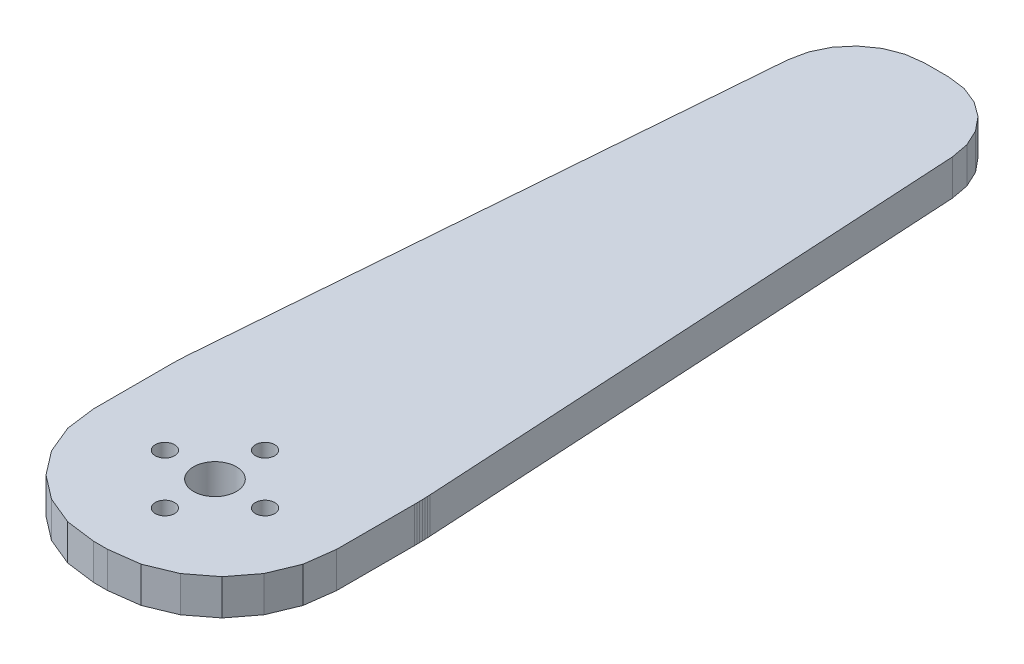
from build123d import *

# Parameters (mm, degrees)
BOSS_1_DEPTH = 5
S_HOLE2_R    = 3
HOLE_2_DEPTH = 5.2
S_HOLE3_R    = 1.35
HOLE_3_DEPTH = 5.2
S_HOLE4_R    = 1.35
HOLE_4_DEPTH = 5.2
S_HOLE5_R    = 1.35
HOLE_5_DEPTH = 5.2
S_HOLE6_R    = 1.35
HOLE_6_DEPTH = 5.2


with BuildPart() as part:
    # S_prism1 → Boss_1 (new body)
    with BuildSketch(Plane(origin=(0, -5, 0), x_dir=(1, 0, 0), z_dir=(0, 1, 0))):
        Polygon((-17, 0), (-16.455, -4.141), (-14.856, -8), (-12.314, -11.314), (-9, -13.856), (-5.141, -15.455), (-1, -16), (1, -16), (5.141, -15.455), (9, -13.856), (12.314, -11.314), (14.856, -8), (16.455, -4.141), (17, 0), (17, 10.865), (16.998, 11.243), (16.993, 11.621), (16.984, 12), (16.971, 12.378), (16.955, 12.756), (16.936, 13.134), (12.536, 90.567), (12.078, 93.042), (11.017, 95.324), (9.42, 97.269), (7.387, 98.753), (5.049, 99.683), (2.552, 100), (-0.764, 100), (-3.224, 99.693), (-5.533, 98.79), (-7.549, 97.346), (-9.148, 95.451), (-10.231, 93.221), (-10.732, 90.793), (-16.874, 13.583), (-16.913, 13.056), (-16.944, 12.527), (-16.968, 11.999), (-16.986, 11.47), (-16.996, 10.941), (-17, 10.412), align=None)
    extrude(amount=BOSS_1_DEPTH)

    # S_hole2 → Hole_2 (cut)
    with BuildSketch(Plane(origin=(0, -5.1, 0), x_dir=(1, 0, 0), z_dir=(0, 1, 0))):
        Circle(S_HOLE2_R)
    extrude(amount=HOLE_2_DEPTH, mode=Mode.SUBTRACT)

    # S_hole3 → Hole_3 (cut)
    with BuildSketch(Plane(origin=(0, -5.1, 0), x_dir=(1, 0, 0), z_dir=(0, 1, 0))):
        with Locations((7, 0)):
            Circle(S_HOLE3_R)
    extrude(amount=HOLE_3_DEPTH, mode=Mode.SUBTRACT)

    # S_hole4 → Hole_4 (cut)
    with BuildSketch(Plane(origin=(0, -5.1, 0), x_dir=(1, 0, 0), z_dir=(0, 1, 0))):
        with Locations((0, -7)):
            Circle(S_HOLE4_R)
    extrude(amount=HOLE_4_DEPTH, mode=Mode.SUBTRACT)

    # S_hole5 → Hole_5 (cut)
    with BuildSketch(Plane(origin=(0, -5.1, 0), x_dir=(1, 0, 0), z_dir=(0, 1, 0))):
        with Locations((-7, 0)):
            Circle(S_HOLE5_R)
    extrude(amount=HOLE_5_DEPTH, mode=Mode.SUBTRACT)

    # S_hole6 → Hole_6 (cut)
    with BuildSketch(Plane(origin=(0, -5.1, 0), x_dir=(1, 0, 0), z_dir=(0, 1, 0))):
        with Locations((0, 7)):
            Circle(S_HOLE6_R)
    extrude(amount=HOLE_6_DEPTH, mode=Mode.SUBTRACT)


solid = part.part
